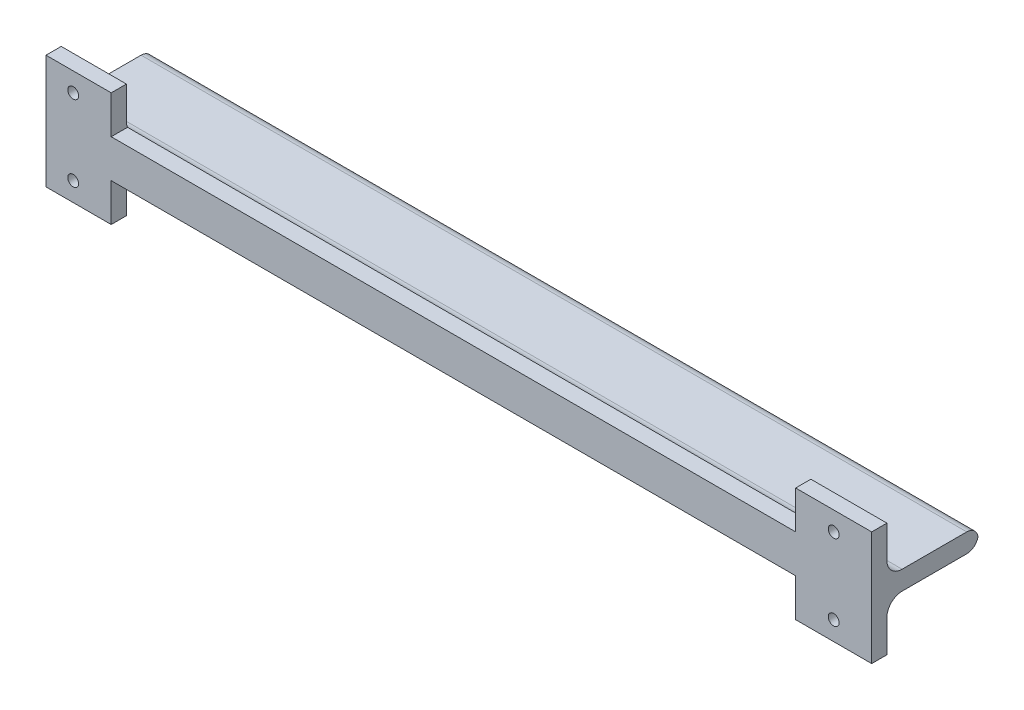
from build123d import *

# Parameters (mm, degrees)
SKETCH1_R           = 1.425
BOSS_EXTRUDE1_DEPTH = 4
SKETCH2_W           = 217.15
SKETCH2_H           = 5
BOSS_EXTRUDE2_DEPTH = 24
FILLET1_R           = 4
FILLET2_R           = 3


with BuildPart() as part:
    # Sketch1 → Boss-Extrude1 (new body)
    with BuildSketch(Plane.XY):
        Polygon((110, -15), (90, -15), (90, -5), (-90, -5), (-90, -15), (-107.15, -15), (-107.15, 15), (-90, 15), (-90, 5), (90, 5), (90, 15), (110, 15), align=None)
        with Locations((100, 10)):
            Circle(SKETCH1_R, mode=Mode.SUBTRACT)
        with Locations((100, -10)):
            Circle(SKETCH1_R, mode=Mode.SUBTRACT)
        with Locations((-100, -10)):
            Circle(SKETCH1_R, mode=Mode.SUBTRACT)
        with Locations((-100, 10)):
            Circle(SKETCH1_R, mode=Mode.SUBTRACT)
    extrude(amount=-BOSS_EXTRUDE1_DEPTH)

    # Sketch2 → Boss-Extrude2 (add)
    with BuildSketch(Plane(origin=(0, 0, -4), x_dir=(-1, 0, 0), z_dir=(0, 0, -1))):
        with Locations((-1.425, 0)):
            Rectangle(SKETCH2_W, SKETCH2_H)
    extrude(amount=BOSS_EXTRUDE2_DEPTH)

    # Fillet1
    # the kernel refuses this fillet: 4 mm, written as the material it adds along each edge
    with BuildSketch(Plane(origin=(-107.15, 2.5, -4), x_dir=(0, 1, 0), z_dir=(1, 0, 0))) as fillet1_piece_1_section:
        with BuildLine():
            CenterArc((FILLET1_R, -FILLET1_R), FILLET1_R, 90, 90)
            Line((0, -FILLET1_R), (0, 0))
            Line((0, 0), (FILLET1_R, 0))
        make_face()
    fillet1_piece_1 = extrude(amount=217.15, mode=Mode.PRIVATE)
    fillet1_piece_1 = split(fillet1_piece_1, bisect_by=Plane(origin=(-98.575, 5, -4.029214959), z_dir=(0, 1, 0)), keep=Keep.TOP, mode=Mode.PRIVATE)
    fillet1_piece_1 = split(fillet1_piece_1, bisect_by=Plane(origin=(-90, 5.544093945, -4.029214959), z_dir=(-1, 0, 0)), keep=Keep.TOP, mode=Mode.PRIVATE)
    add(fillet1_piece_1)
    with BuildSketch(Plane(origin=(-107.15, 2.5, -4), x_dir=(0, 1, 0), z_dir=(1, 0, 0))) as fillet1_piece_2_section:
        with BuildLine():
            CenterArc((FILLET1_R, -FILLET1_R), FILLET1_R, 90, 90)
            Line((0, -FILLET1_R), (0, 0))
            Line((0, 0), (FILLET1_R, 0))
        make_face()
    fillet1_piece_2 = extrude(amount=217.15, mode=Mode.PRIVATE)
    fillet1_piece_2 = split(fillet1_piece_2, bisect_by=Plane(origin=(-98.575, 5, -4.966148005), z_dir=(0, -1, 0)), keep=Keep.TOP, mode=Mode.PRIVATE)
    fillet1_piece_2 = split(fillet1_piece_2, bisect_by=Plane(origin=(-90, 3.257783084, -4.966148005), z_dir=(-1, 0, 0)), keep=Keep.TOP, mode=Mode.PRIVATE)
    add(fillet1_piece_2)
    with BuildSketch(Plane(origin=(-107.15, 2.5, -4), x_dir=(0, 1, 0), z_dir=(1, 0, 0))) as fillet1_piece_3_section:
        with BuildLine():
            CenterArc((FILLET1_R, -FILLET1_R), FILLET1_R, 90, 90)
            Line((0, -FILLET1_R), (0, 0))
            Line((0, 0), (FILLET1_R, 0))
        make_face()
    fillet1_piece_3 = extrude(amount=217.15, mode=Mode.PRIVATE)
    fillet1_piece_3 = split(fillet1_piece_3, bisect_by=Plane(origin=(90, 3.257783084, -4.966148005), z_dir=(-1, 0, 0)), keep=Keep.TOP, mode=Mode.PRIVATE)
    fillet1_piece_3 = split(fillet1_piece_3, bisect_by=Plane(origin=(0, 5, -4.966148005), z_dir=(0, -1, 0)), keep=Keep.TOP, mode=Mode.PRIVATE)
    fillet1_piece_3 = split(fillet1_piece_3, bisect_by=Plane(origin=(-90, 3.257783084, -4.966148005), z_dir=(1, 0, 0)), keep=Keep.TOP, mode=Mode.PRIVATE)
    add(fillet1_piece_3)
    with BuildSketch(Plane(origin=(-107.15, 2.5, -4), x_dir=(0, 1, 0), z_dir=(1, 0, 0))) as fillet1_piece_4_section:
        with BuildLine():
            CenterArc((FILLET1_R, -FILLET1_R), FILLET1_R, 90, 90)
            Line((0, -FILLET1_R), (0, 0))
            Line((0, 0), (FILLET1_R, 0))
        make_face()
    fillet1_piece_4 = extrude(amount=217.15, mode=Mode.PRIVATE)
    fillet1_piece_4 = split(fillet1_piece_4, bisect_by=Plane(origin=(90, 5.544093945, -4.029214959), z_dir=(1, 0, 0)), keep=Keep.TOP, mode=Mode.PRIVATE)
    fillet1_piece_4 = split(fillet1_piece_4, bisect_by=Plane(origin=(100, 5, -4.029214959), z_dir=(0, 1, 0)), keep=Keep.TOP, mode=Mode.PRIVATE)
    add(fillet1_piece_4)
    with BuildSketch(Plane(origin=(-107.15, 2.5, -4), x_dir=(0, 1, 0), z_dir=(1, 0, 0))) as fillet1_piece_5_section:
        with BuildLine():
            CenterArc((FILLET1_R, -FILLET1_R), FILLET1_R, 90, 90)
            Line((0, -FILLET1_R), (0, 0))
            Line((0, 0), (FILLET1_R, 0))
        make_face()
    fillet1_piece_5 = extrude(amount=217.15, mode=Mode.PRIVATE)
    fillet1_piece_5 = split(fillet1_piece_5, bisect_by=Plane(origin=(90, 3.257783084, -4.966148005), z_dir=(1, 0, 0)), keep=Keep.TOP, mode=Mode.PRIVATE)
    fillet1_piece_5 = split(fillet1_piece_5, bisect_by=Plane(origin=(100, 5, -4.966148005), z_dir=(0, -1, 0)), keep=Keep.TOP, mode=Mode.PRIVATE)
    add(fillet1_piece_5)
    with BuildSketch(Plane(origin=(110, -2.5, -4), x_dir=(0, -1, 0), z_dir=(-1, 0, 0))) as fillet1_piece_6_section:
        with BuildLine():
            CenterArc((FILLET1_R, -FILLET1_R), FILLET1_R, 90, 90)
            Line((0, -FILLET1_R), (0, 0))
            Line((0, 0), (FILLET1_R, 0))
        make_face()
    fillet1_piece_6 = extrude(amount=217.15, mode=Mode.PRIVATE)
    fillet1_piece_6 = split(fillet1_piece_6, bisect_by=Plane(origin=(90, -5.544093945, -4.029214959), z_dir=(1, 0, 0)), keep=Keep.TOP, mode=Mode.PRIVATE)
    fillet1_piece_6 = split(fillet1_piece_6, bisect_by=Plane(origin=(100, -5, -4.029214959), z_dir=(0, -1, 0)), keep=Keep.TOP, mode=Mode.PRIVATE)
    add(fillet1_piece_6)
    with BuildSketch(Plane(origin=(110, -2.5, -4), x_dir=(0, -1, 0), z_dir=(-1, 0, 0))) as fillet1_piece_7_section:
        with BuildLine():
            CenterArc((FILLET1_R, -FILLET1_R), FILLET1_R, 90, 90)
            Line((0, -FILLET1_R), (0, 0))
            Line((0, 0), (FILLET1_R, 0))
        make_face()
    fillet1_piece_7 = extrude(amount=217.15, mode=Mode.PRIVATE)
    fillet1_piece_7 = split(fillet1_piece_7, bisect_by=Plane(origin=(90, -3.257783084, -4.966148005), z_dir=(1, 0, 0)), keep=Keep.TOP, mode=Mode.PRIVATE)
    fillet1_piece_7 = split(fillet1_piece_7, bisect_by=Plane(origin=(100, -5, -4.966148005), z_dir=(0, 1, 0)), keep=Keep.TOP, mode=Mode.PRIVATE)
    add(fillet1_piece_7)
    with BuildSketch(Plane(origin=(110, -2.5, -4), x_dir=(0, -1, 0), z_dir=(-1, 0, 0))) as fillet1_piece_8_section:
        with BuildLine():
            CenterArc((FILLET1_R, -FILLET1_R), FILLET1_R, 90, 90)
            Line((0, -FILLET1_R), (0, 0))
            Line((0, 0), (FILLET1_R, 0))
        make_face()
    fillet1_piece_8 = extrude(amount=217.15, mode=Mode.PRIVATE)
    fillet1_piece_8 = split(fillet1_piece_8, bisect_by=Plane(origin=(90, -3.257783084, -4.966148005), z_dir=(-1, 0, 0)), keep=Keep.TOP, mode=Mode.PRIVATE)
    fillet1_piece_8 = split(fillet1_piece_8, bisect_by=Plane(origin=(-90, -3.257783084, -4.966148005), z_dir=(1, 0, 0)), keep=Keep.TOP, mode=Mode.PRIVATE)
    fillet1_piece_8 = split(fillet1_piece_8, bisect_by=Plane(origin=(0, -5, -4.966148005), z_dir=(0, 1, 0)), keep=Keep.TOP, mode=Mode.PRIVATE)
    add(fillet1_piece_8)
    with BuildSketch(Plane(origin=(110, -2.5, -4), x_dir=(0, -1, 0), z_dir=(-1, 0, 0))) as fillet1_piece_9_section:
        with BuildLine():
            CenterArc((FILLET1_R, -FILLET1_R), FILLET1_R, 90, 90)
            Line((0, -FILLET1_R), (0, 0))
            Line((0, 0), (FILLET1_R, 0))
        make_face()
    fillet1_piece_9 = extrude(amount=217.15, mode=Mode.PRIVATE)
    fillet1_piece_9 = split(fillet1_piece_9, bisect_by=Plane(origin=(-90, -5.544093945, -4.029214959), z_dir=(-1, 0, 0)), keep=Keep.TOP, mode=Mode.PRIVATE)
    fillet1_piece_9 = split(fillet1_piece_9, bisect_by=Plane(origin=(-98.575, -5, -4.029214959), z_dir=(0, -1, 0)), keep=Keep.TOP, mode=Mode.PRIVATE)
    add(fillet1_piece_9)
    with BuildSketch(Plane(origin=(110, -2.5, -4), x_dir=(0, -1, 0), z_dir=(-1, 0, 0))) as fillet1_piece_10_section:
        with BuildLine():
            CenterArc((FILLET1_R, -FILLET1_R), FILLET1_R, 90, 90)
            Line((0, -FILLET1_R), (0, 0))
            Line((0, 0), (FILLET1_R, 0))
        make_face()
    fillet1_piece_10 = extrude(amount=217.15, mode=Mode.PRIVATE)
    fillet1_piece_10 = split(fillet1_piece_10, bisect_by=Plane(origin=(-90, -3.257783084, -4.966148005), z_dir=(-1, 0, 0)), keep=Keep.TOP, mode=Mode.PRIVATE)
    fillet1_piece_10 = split(fillet1_piece_10, bisect_by=Plane(origin=(-98.575, -5, -4.966148005), z_dir=(0, 1, 0)), keep=Keep.TOP, mode=Mode.PRIVATE)
    add(fillet1_piece_10)

    # Fillet2
    # the kernel refuses this fillet: 3 mm, written as the material it takes off along each edge
    with BuildSketch(Plane(origin=(117.5, -2.5, -28), x_dir=(0, 1, 0), z_dir=(-1, 0, 0))) as fillet2_piece_1:
        with BuildLine():
            CenterArc((FILLET2_R, -FILLET2_R), FILLET2_R, 90, 90)
            Line((0, -FILLET2_R), (0, 0))
            Line((0, 0), (FILLET2_R, 0))
        make_face()
    extrude(amount=232.15, mode=Mode.SUBTRACT)
    with BuildSketch(Plane(origin=(-114.65, 2.5, -28), x_dir=(0, 0, 1), z_dir=(1, 0, 0))) as fillet2_piece_2:
        with BuildLine():
            CenterArc((FILLET2_R, FILLET2_R), FILLET2_R, 180, 90)
            Line((0, FILLET2_R), (0, 0))
            Line((0, 0), (FILLET2_R, 0))
        make_face()
    extrude(amount=232.15, mode=Mode.SUBTRACT)


solid = part.part
